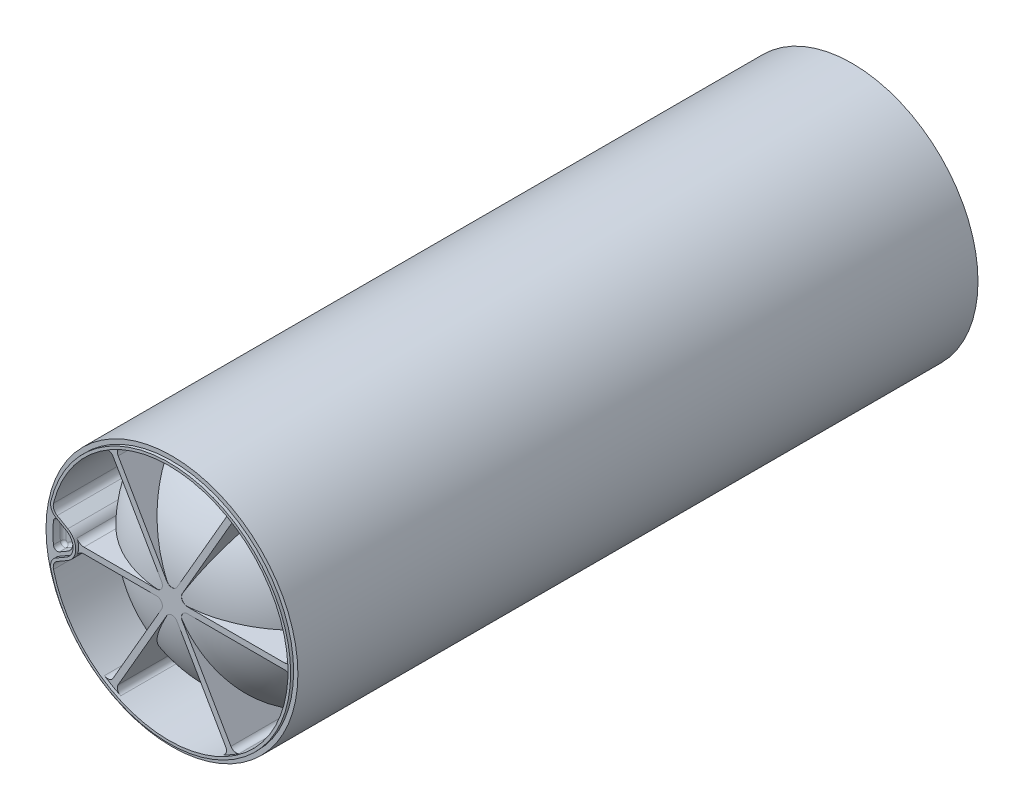
from build123d import *

# Parameters (mm, degrees)
SKETCH1_R           = 63.5
BOSS_EXTRUDE1_DEPTH = 342.9
FILLET1_R           = 60
SHELL1_T            = -1.5875
BOSS_EXTRUDE6_REACH = 377.671
SKETCH8_R           = 63.5
CUT_EXTRUDE1_DEPTH  = 5
SKETCH12_R          = 2
CUT_EXTRUDE2_DEPTH  = 30
SKETCH13_R          = 4
CUT_EXTRUDE3_DEPTH  = 327.56
BOSS_EXTRUDE7_START = 1.5
BOSS_EXTRUDE7_DEPTH = 1.5
FILLET2_R           = 1.5


with BuildPart() as part:
    # Sketch1 → Boss-Extrude1 (new body)
    with BuildSketch(Plane.XY):
        with Locations((-76.2, 0)):
            Circle(SKETCH1_R)
    extrude(amount=BOSS_EXTRUDE1_DEPTH)

    # Fillet1
    fillet1_edges = [part.edges().sort_by_distance(p)[0] for p in [
        (-139.7, 0, 342.9),
    ]]
    fillet(fillet1_edges, radius=FILLET1_R)

    # Shell1
    shell1_openings = [part.faces().sort_by_distance(p)[0] for p in [
        (-76.2, 0, 0),
    ]]
    offset(amount=SHELL1_T, openings=shell1_openings, kind=Kind.INTERSECTION)

    # Sketch8 → Boss-Extrude6 (add, up to next)
    with BuildSketch(Plane.XY.offset(342.9), mode=Mode.PRIVATE) as boss_extrude6_sk1:
        with Locations((-76.2, 0)):
            Circle(SKETCH8_R)
        with BuildLine():
            Line((-120.534635496, -1.5), (-83.994228634, -1.5))
            ThreePointArc((-83.994228634, -1.5), (-81.396152423, -3), (-81.396152423, -6))
            Line((-81.396152423, -6), (-105.910083493, -48.459374107))
            ThreePointArc((-105.910083493, -48.459374107), (-107.846783991, -49.885563125), (-110.208589162, -49.430920113))
            ThreePointArc((-110.208589162, -49.430920113), (-125.527605856, -34.158268407), (-134.435045516, -14.445742407))
            ThreePointArc((-134.435045516, -14.445742407), (-134.233794182, -11.917568963), (-132.552709149, -10.018591298))
            Line((-132.552709149, -10.018591298), (-127.2, -6.92820323))
            ThreePointArc((-127.2, -6.92820323), (-125.410459424, -5.520979978), (-124.089756997, -3.666666667))
            ThreePointArc((-124.089756997, -3.666666667), (-122.616301496, -2.084349745), (-120.534635496, -1.5))
        make_face(mode=Mode.SUBTRACT)
        with BuildLine():
            Line((-105.910083493, 48.459374107), (-81.396152423, 6))
            ThreePointArc((-81.396152423, 6), (-81.396152423, 3), (-83.994228634, 1.5))
            Line((-83.994228634, 1.5), (-120.534635496, 1.5))
            ThreePointArc((-120.534635496, 1.5), (-122.616301496, 2.084349745), (-124.089756997, 3.666666667))
            ThreePointArc((-124.089756997, 3.666666667), (-125.410459424, 5.520979978), (-127.2, 6.92820323))
            Line((-127.2, 6.92820323), (-132.552709149, 10.018591298))
            ThreePointArc((-132.552709149, 10.018591298), (-134.233794182, 11.917568963), (-134.435045516, 14.445742407))
            ThreePointArc((-134.435045516, 14.445742407), (-125.527605856, 34.158268407), (-110.208589162, 49.430920113))
            ThreePointArc((-110.208589162, 49.430920113), (-107.846783991, 49.885563125), (-105.910083493, 48.459374107))
        make_face(mode=Mode.SUBTRACT)
        with BuildLine():
            Line((-103.312007282, -49.959374107), (-78.798076211, -7.5))
            ThreePointArc((-78.798076211, -7.5), (-76.2, -6), (-73.601923789, -7.5))
            Line((-73.601923789, -7.5), (-49.087992718, -49.959374107))
            ThreePointArc((-49.087992718, -49.959374107), (-48.821227048, -52.349700447), (-50.395862031, -54.167762218))
            ThreePointArc((-50.395862031, -54.167762218), (-76.2, -60), (-102.004137969, -54.167762218))
            ThreePointArc((-102.004137969, -54.167762218), (-103.578772952, -52.349700447), (-103.312007282, -49.959374107))
        make_face(mode=Mode.SUBTRACT)
        with BuildLine():
            Line((-103.312007282, 49.959374107), (-78.798076211, 7.5))
            ThreePointArc((-78.798076211, 7.5), (-76.2, 6), (-73.601923789, 7.5))
            Line((-73.601923789, 7.5), (-49.087992718, 49.959374107))
            ThreePointArc((-49.087992718, 49.959374107), (-48.821227048, 52.349700447), (-50.395862031, 54.167762218))
            ThreePointArc((-50.395862031, 54.167762218), (-76.2, 60), (-102.004137969, 54.167762218))
            ThreePointArc((-102.004137969, 54.167762218), (-103.578772952, 52.349700447), (-103.312007282, 49.959374107))
        make_face(mode=Mode.SUBTRACT)
        with BuildLine():
            Line((-68.405771366, 1.5), (-19.377909225, 1.5))
            ThreePointArc((-19.377909225, 1.5), (-17.174443056, 2.464137322), (-16.387272869, 4.736842105))
            ThreePointArc((-16.387272869, 4.736842105), (-24.238475773, 30), (-42.191410838, 49.430920113))
            ThreePointArc((-42.191410838, 49.430920113), (-44.553216009, 49.885563125), (-46.489916507, 48.459374107))
            Line((-46.489916507, 48.459374107), (-71.003847577, 6))
            ThreePointArc((-71.003847577, 6), (-71.003847577, 3), (-68.405771366, 1.5))
        make_face(mode=Mode.SUBTRACT)
        with BuildLine():
            Line((-71.003847577, -6), (-46.489916507, -48.459374107))
            ThreePointArc((-46.489916507, -48.459374107), (-44.553216009, -49.885563125), (-42.191410838, -49.430920113))
            ThreePointArc((-42.191410838, -49.430920113), (-24.238475773, -30), (-16.387272869, -4.736842105))
            ThreePointArc((-16.387272869, -4.736842105), (-17.174443056, -2.464137322), (-19.377909225, -1.5))
            Line((-19.377909225, -1.5), (-68.405771366, -1.5))
            ThreePointArc((-68.405771366, -1.5), (-71.003847577, -3), (-71.003847577, -6))
        make_face(mode=Mode.SUBTRACT)
    boss_extrude6_tool1 = extrude(boss_extrude6_sk1.sketch, amount=-BOSS_EXTRUDE6_REACH, mode=Mode.PRIVATE) - part.part
    add(boss_extrude6_tool1.solids().sort_by_distance((-79.586292, 0, 342.9))[0])

    # Sketch11 → Cut-Extrude1 (cut)
    with BuildSketch(Plane.XY.offset(342.9)):
        with BuildLine():
            Line((-132.978150632, 6.800118438), (-128.7, 4.330127019))
            ThreePointArc((-128.7, 4.330127019), (-126.2, 0), (-128.7, -4.330127019))
            Line((-128.7, -4.330127019), (-132.978150632, -6.800118438))
            ThreePointArc((-132.978150632, -6.800118438), (-134.901447748, -6.842193454), (-135.970500654, -5.242828583))
            ThreePointArc((-135.970500654, -5.242828583), (-136.2, 0), (-135.970500654, 5.242828583))
            ThreePointArc((-135.970500654, 5.242828583), (-134.901447748, 6.842193453), (-132.978150632, 6.800118438))
        make_face()
    extrude(amount=-CUT_EXTRUDE1_DEPTH, mode=Mode.SUBTRACT)

    # Sketch12 → Cut-Extrude2 (cut)
    with BuildSketch(Plane.XY.offset(337.9)):
        with Locations((-131.2, 0)):
            Circle(SKETCH12_R)
    extrude(amount=-CUT_EXTRUDE2_DEPTH, mode=Mode.SUBTRACT)

    # Sketch13 → Cut-Extrude3 (cut)
    with BuildSketch(Plane(origin=(0, 0, 0), x_dir=(-1, 0, 0), z_dir=(0, 0, -1))):
        with Locations((131.2, 0)):
            Circle(SKETCH13_R)
    extrude(amount=-CUT_EXTRUDE3_DEPTH, mode=Mode.SUBTRACT)

    # Sketch9 → Boss-Extrude7 (add)
    with BuildSketch(Plane.XY.offset(342.9).offset(BOSS_EXTRUDE7_START)):
        with BuildLine():
            Line((-133.227709149, 8.849457003), (-127.875, 5.759068935))
            ThreePointArc((-127.875, 5.759068935), (-124.55, 0), (-127.875, -5.759068935))
            Line((-127.875, -5.759068935), (-133.227709149, -8.849457003))
            ThreePointArc((-133.227709149, -8.849457003), (-135.476160381, -11.38933963), (-135.745334041, -14.770771611))
            ThreePointArc((-135.745334041, -14.770771611), (-14.85, 0), (-135.745334041, 14.770771611))
            ThreePointArc((-135.745334041, 14.770771611), (-135.476160381, 11.38933963), (-133.227709149, 8.849457003))
        make_face()
        with BuildLine():
            Line((-132.552709149, 10.018591298), (-127.2, 6.92820323))
            ThreePointArc((-127.2, 6.92820323), (-123.2, 0), (-127.2, -6.92820323))
            Line((-127.2, -6.92820323), (-132.552709149, -10.018591298))
            ThreePointArc((-132.552709149, -10.018591298), (-134.233794182, -11.917568963), (-134.435045516, -14.445742407))
            ThreePointArc((-134.435045516, -14.445742407), (-16.2, 0), (-134.435045516, 14.445742407))
            ThreePointArc((-134.435045516, 14.445742407), (-134.233794182, 11.917568963), (-132.552709149, 10.018591298))
        make_face(mode=Mode.SUBTRACT)
    extrude(amount=-BOSS_EXTRUDE7_DEPTH)

    # Fillet2
    fillet2_edges = [part.edges().sort_by_distance(p)[0] for p in [
        (-130.839075316, -5.565122729, 337.9),
        (-126.2, 0, 337.9),
        (-130.839075316, 5.565122729, 337.9),
        (-134.901447748, 6.842193453, 337.9),
        (-136.2, 0, 337.9),
        (-134.901447748, -6.842193454, 337.9),
        (-127.2, 0, 327.56),
    ]]
    fillet(fillet2_edges, radius=FILLET2_R)


solid = part.part
